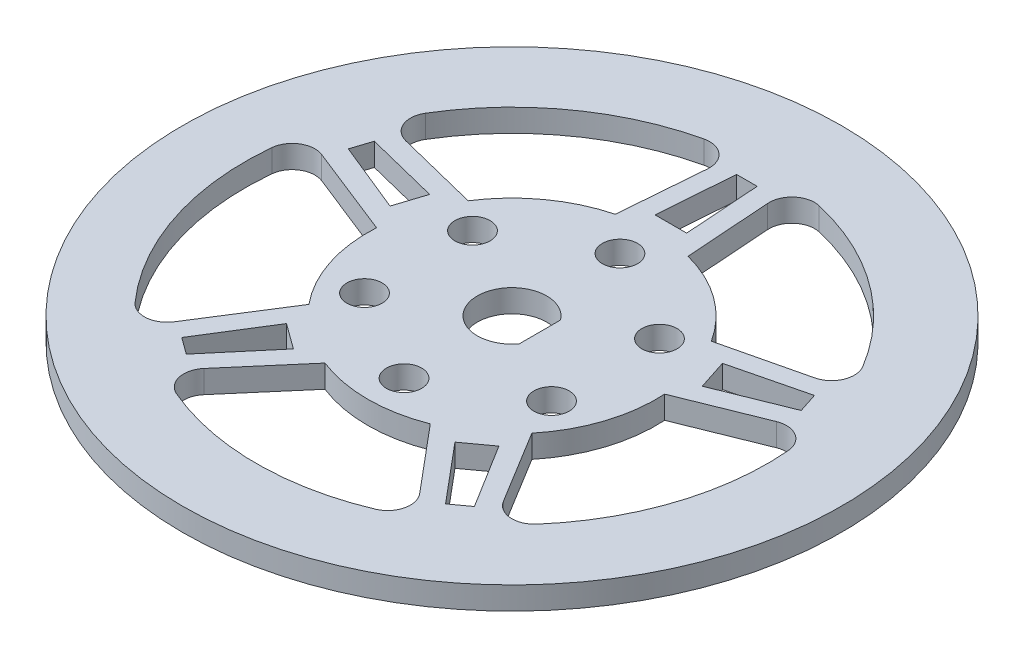
from build123d import *

# Parameters (mm, degrees)
SKETCH1_R           = 29
SKETCH1_R_2         = 1.55
BOSS_EXTRUDE1_DEPTH = 2
FILLET1_R           = 2


with BuildPart() as part:
    # Sketch1 → Boss-Extrude1 (new body)
    with BuildSketch(Plane(origin=(0, 0, 0), x_dir=(1, 0, 0), z_dir=(0, 1, 0))):
        Circle(SKETCH1_R)
        with Locations((0, 9.5)):
            Circle(SKETCH1_R_2, mode=Mode.SUBTRACT)
        with Locations((8.227241336, 4.75)):
            Circle(SKETCH1_R_2, mode=Mode.SUBTRACT)
        with Locations((8.227241336, -4.75)):
            Circle(SKETCH1_R_2, mode=Mode.SUBTRACT)
        with Locations((0, -9.5)):
            Circle(SKETCH1_R_2, mode=Mode.SUBTRACT)
        with Locations((-8.227241336, -4.75)):
            Circle(SKETCH1_R_2, mode=Mode.SUBTRACT)
        with Locations((-8.227241336, 4.75)):
            Circle(SKETCH1_R_2, mode=Mode.SUBTRACT)
        with BuildLine():
            Line((-2.393617021, 22.372317662), (-3.2, 12.29024003))
            ThreePointArc((-3.2, 12.29024003), (-7.464872704, 10.274515829), (-10.699858486, 6.841273886))
            Line((-10.699858486, 6.841273886), (-20.493727723, 9.287471347))
            ThreePointArc((-20.493727723, 9.287471347), (-13.181841227, 18.234282598), (-2.393617021, 22.372317662))
        make_face(mode=Mode.SUBTRACT)
        with BuildLine():
            Line((2.5, 22.360679775), (3.2, 12.29024003))
            ThreePointArc((3.2, 12.29024003), (7.464872704, 10.274515829), (10.699858486, 6.841273886))
            Line((10.699858486, 6.841273886), (20.537670159, 9.189891427))
            ThreePointArc((20.537670159, 9.189891427), (13.268420329, 18.171379199), (2.5, 22.360679775))
        make_face(mode=Mode.SUBTRACT)
        Polygon((-0.904044158, 20.660679775), (-1.389172956, 13.99024003), (1.377730381, 13.99024003), (0.914065641, 20.660679775), align=None, mode=Mode.SUBTRACT)
        Polygon((13.731251047, 3.012922468), (19.931935948, 5.515173081), (19.370109123, 7.244298253), (12.876230894, 5.644403917), align=None, mode=Mode.SUBTRACT)
        with BuildLine():
            Line((22.038812695, 4.532188766), (12.67756725, 0.754512182))
            ThreePointArc((12.67756725, 0.754512182), (12.078417757, -3.924515829), (9.812876219, -8.062100242))
            Line((9.812876219, -8.062100242), (15.086595229, -16.692652407))
            ThreePointArc((15.086595229, -16.692652407), (21.382175967, -7.003752631), (22.038812695, 4.532188766))
        make_face(mode=Mode.SUBTRACT)
        Polygon((7.108649474, -12.128151539), (11.404548236, -17.252115357), (12.875429962, -16.18345723), (9.347121295, -10.501806564), align=None, mode=Mode.SUBTRACT)
        with BuildLine():
            Line((11.120735317, -19.559633074), (4.635167455, -11.823925857))
            ThreePointArc((4.635167455, -11.823925857), (0, -12.7), (-4.635167455, -11.823925857))
            Line((-4.635167455, -11.823925857), (-11.213641533, -19.506517977))
            ThreePointArc((-11.213641533, -19.506517977), (-0.053508828, -22.499936373), (11.120735317, -19.559633074))
        make_face(mode=Mode.SUBTRACT)
        Polygon((-9.337864058, -10.50853234), (-12.883537512, -16.17756675), (-11.412655787, -17.246224877), (-7.099392236, -12.134877316), align=None, mode=Mode.SUBTRACT)
        with BuildLine():
            Line((-15.757110573, -17.43454807), (-9.812876219, -8.062100242))
            ThreePointArc((-9.812876219, -8.062100242), (-12.078417757, -3.924515829), (-12.67756725, 0.754512182))
            Line((-12.67756725, 0.754512182), (-22.995540471, 4.843048464))
            ThreePointArc((-22.995540471, 4.843048464), (-22.349828133, -7.261899368), (-15.757110573, -17.43454807))
        make_face(mode=Mode.SUBTRACT)
        Polygon((-12.879766844, 5.633521381), (-19.367012314, 7.25382925), (-19.92883914, 5.524704078), (-13.734786997, 3.002039933), align=None, mode=Mode.SUBTRACT)
        with BuildLine():
            Line((2.45, 1.816590212), (2.45, -1.816590212))
            ThreePointArc((2.45, -1.816590212), (-3.05, 0), (2.45, 1.816590212))
        make_face(mode=Mode.SUBTRACT)
    extrude(amount=BOSS_EXTRUDE1_DEPTH)

    # Fillet1
    fillet1_edges = [part.edges().sort_by_distance(p)[0] for p in [
        (-11.213641533, 1, 19.506517977),
        (11.120735317, 1, 19.559633074),
        (15.086595229, 1, 16.692652407),
        (22.038812695, 1, -4.532188766),
        (2.5, 1, -22.360679775),
        (20.537670159, 1, -9.189891427),
        (-2.393617021, 1, -22.372317662),
        (-20.493727723, 1, -9.287471347),
        (-22.995540471, 1, -4.843048464),
        (-15.757110573, 1, 17.43454807),
    ]]
    fillet(fillet1_edges, radius=FILLET1_R)


solid = part.part
